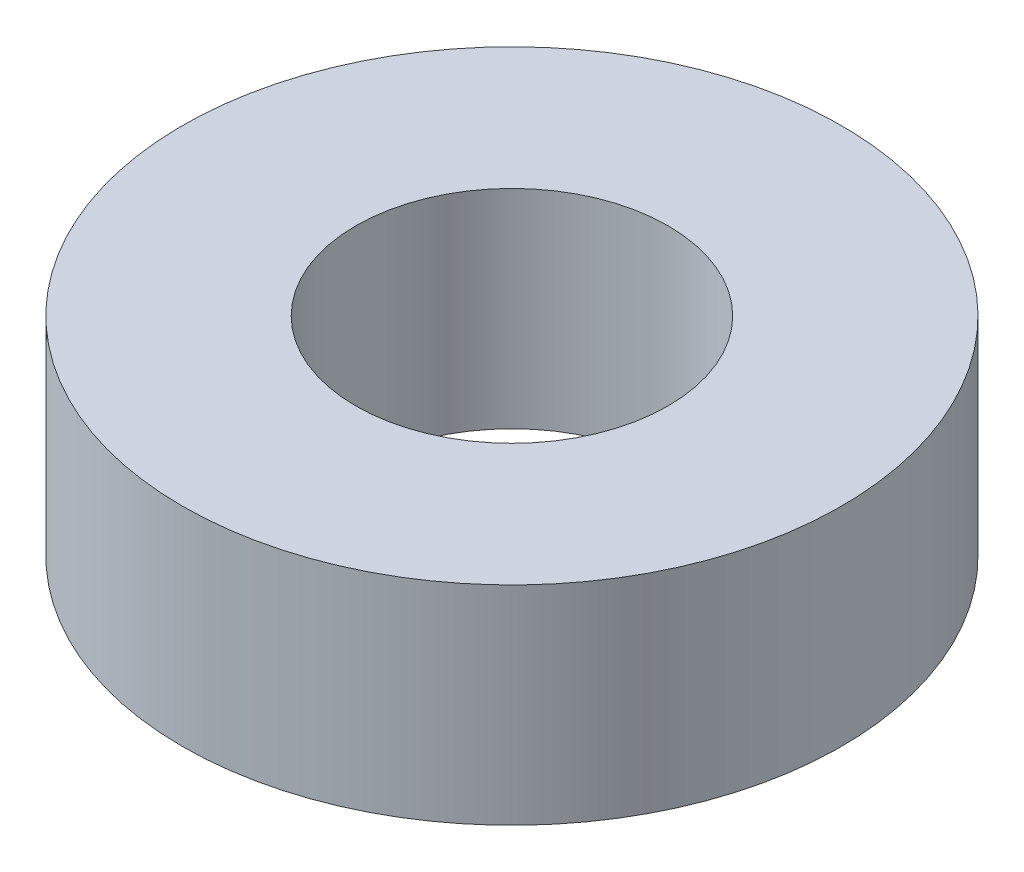
from build123d import *

# Parameters (mm, degrees)
SKETCH1_R           = 47.5
BOSS_EXTRUDE1_DEPTH = 30
SKETCH2_R           = 22.5
CUT_EXTRUDE1_DEPTH  = 74.569694848


with BuildPart() as part:
    # Sketch1 → Boss-Extrude1 (new body)
    with BuildSketch(Plane(origin=(0, 0, 0), x_dir=(1, 0, 0), z_dir=(0, 1, 0))):
        Circle(SKETCH1_R)
    extrude(amount=BOSS_EXTRUDE1_DEPTH)

    # Sketch2 → Cut-Extrude1 (cut, through all)
    with BuildSketch(Plane(origin=(0, 0, 0), x_dir=(1, 0, 0), z_dir=(0, 1, 0))):
        Circle(SKETCH2_R)
    extrude(amount=CUT_EXTRUDE1_DEPTH, mode=Mode.SUBTRACT)


solid = part.part
